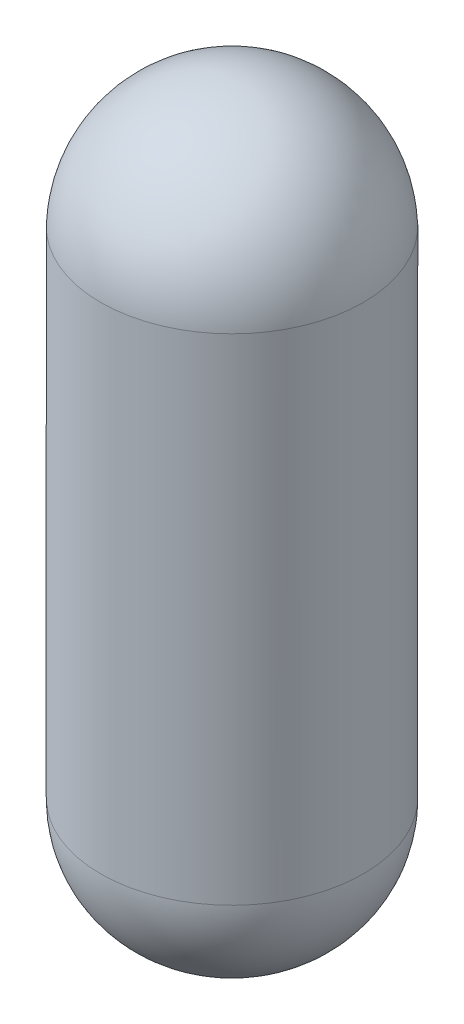
from build123d import *


with BuildPart() as part:
    # Sketch1 → Revolve2 (revolve)
    with BuildSketch(Plane.XY):
        with BuildLine():
            Line((0, 761.73353743), (0, -1270.26646257))
            Line((0, -1270.26646257), (0, -1727.46646257))
            ThreePointArc((0, -1727.46646257), (365.625460337, -1600.620614508), (520.7, -1246.045187319))
            Line((520.7, -1246.045187319), (520.7, 715.646))
            ThreePointArc((520.7, 715.646), (362.086604051, 1072.546199263), (0, 1218.93353743))
            Line((0, 1218.93353743), (0, 761.73353743))
        make_face()
    revolve(axis=Axis((0, 550, 0), (0, -1, 0)))


solid = part.part
